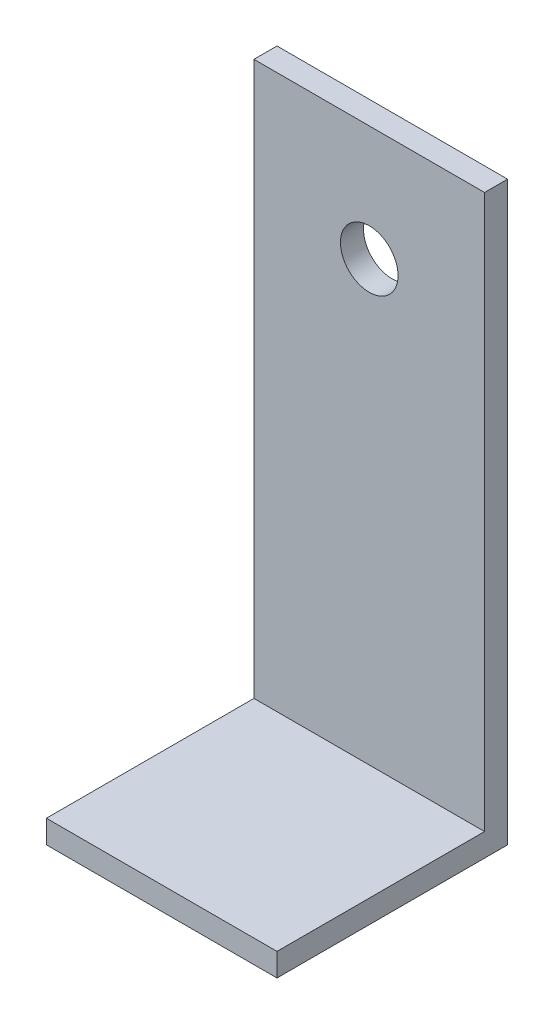
from build123d import *

# Parameters (mm, degrees)
BOSS_EXTRUDE1_DEPTH      = 12.7
BOSS_EXTRUDE1_DEPTH_BACK = 12.7
SKETCH2_R                = 3.175
CUT_EXTRUDE1_DEPTH       = 12.7


with BuildPart() as part:
    # Sketch1 → Boss-Extrude1 (new, two sides: drawn at the far end of the back side and taken through both)
    with BuildSketch(Plane(origin=(0, 0, 0), x_dir=(0, 0, -1), z_dir=(1, 0, 0)).offset(-BOSS_EXTRUDE1_DEPTH_BACK)):
        Polygon((-25.4, 0), (0, 0), (0, 63.5), (-2.54, 63.5), (-2.54, 2.54), (-25.4, 2.54), align=None)
    extrude(amount=BOSS_EXTRUDE1_DEPTH + BOSS_EXTRUDE1_DEPTH_BACK)

    # Sketch2 → Cut-Extrude1 (cut)
    with BuildSketch(Plane.XY.offset(2.54)):
        with Locations((0, 50.8)):
            Circle(SKETCH2_R)
    extrude(amount=-CUT_EXTRUDE1_DEPTH, mode=Mode.SUBTRACT)


solid = part.part
